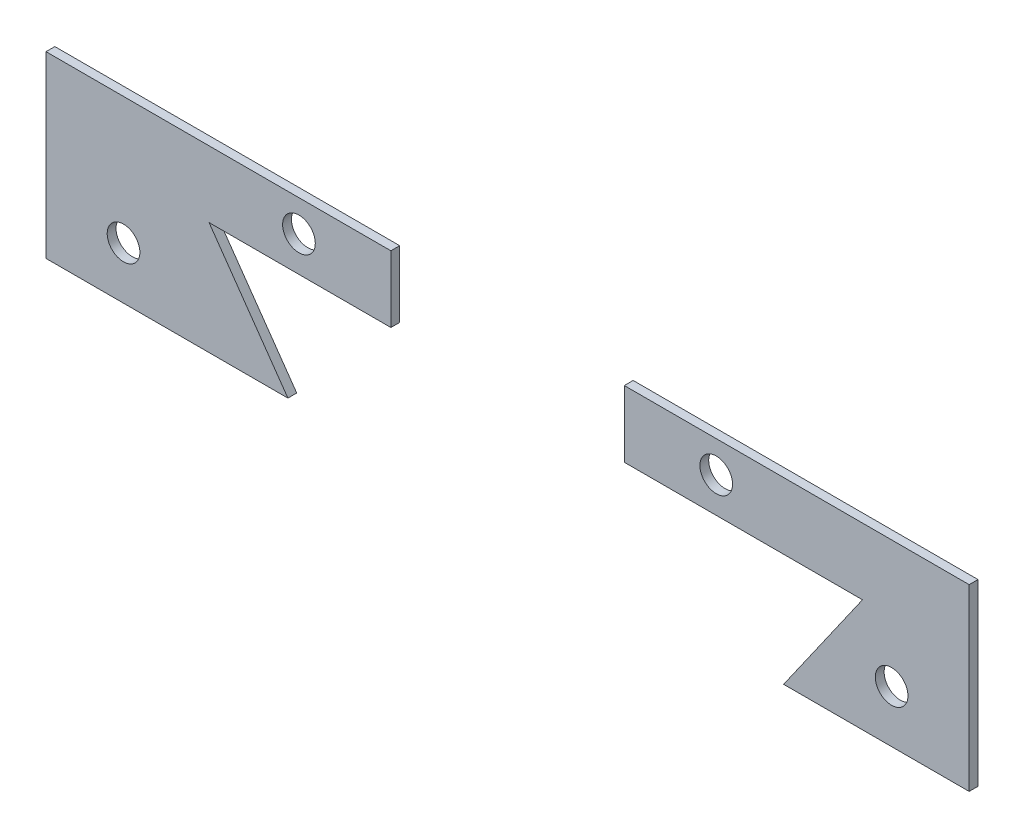
from build123d import *

# Parameters (mm, degrees)
BOSS_EXTRUDE1_DEPTH            = 1.21412
BOSS_EXTRUDE1_2_DEPTH          = 1.21412
SKETCH3_W                      = 2.2479
SKETCH3_H                      = 1.21412
F_8_CLEARANCE_HOLE1_AT_2_COUNT = 2
F_8_CLEARANCE_HOLE1_AT_2_PITCH = 27.477896212
F_8_CLEARANCE_HOLE1_AT_3_COUNT = 2
F_8_CLEARANCE_HOLE1_AT_3_PITCH = 57.404
F_8_CLEARANCE_HOLE1_AT_4_COUNT = 2
F_8_CLEARANCE_HOLE1_AT_4_PITCH = 82.586748551


with BuildPart() as part:
    # Sketch1 → Boss-Extrude1 (new body)
    with BuildSketch(Plane.XY):
        Polygon((-63.5, 0.762), (-30.221075073, 0.762), (-41.07009067, 16.256), (-16.056336319, 16.256), (-16.056336319, 25.4), (-63.5, 25.4), align=None)
    extrude(amount=BOSS_EXTRUDE1_DEPTH)

    # Sketch3 → #8 Clearance Hole1 (revolve, cut)
    with BuildSketch(Plane(origin=(-28.702, 21.082, 1.21412), x_dir=(0, -1, 0), z_dir=(1, 0, 0))):
        with Locations((1.12395, 0.60706)):
            Rectangle(SKETCH3_W, SKETCH3_H)
    f_8_clearance_hole1 = revolve(axis=Axis((-28.702, 21.082, 7.56412), (0, 0, -1)), mode=Mode.SUBTRACT)

    # #8 Clearance Hole1 at 2: #8 Clearance Hole1 ×2
    with Locations(*[Vector(-0.878160388030778, -0.47836631663781826, 0) * (i * F_8_CLEARANCE_HOLE1_AT_2_PITCH) for i in range(1, F_8_CLEARANCE_HOLE1_AT_2_COUNT)]):
        add(f_8_clearance_hole1, mode=Mode.SUBTRACT)


with BuildPart() as body_2:
    # Sketch1 → Boss-Extrude1 2 (new body)
    with BuildSketch(Plane.XY):
        Polygon((16.056336319, 16.256), (48.822009309, 16.256), (37.972993712, 0.762), (63.5, 0.762), (63.5, 25.4), (16.056336319, 25.4), align=None)
    extrude(amount=BOSS_EXTRUDE1_2_DEPTH)

    # #8 Clearance Hole1 at 3: #8 Clearance Hole1 ×2
    with Locations(*[(i * F_8_CLEARANCE_HOLE1_AT_3_PITCH, 0, 0) for i in range(1, F_8_CLEARANCE_HOLE1_AT_3_COUNT)]):
        add(f_8_clearance_hole1, mode=Mode.SUBTRACT)

    # #8 Clearance Hole1 at 4: #8 Clearance Hole1 ×2
    with Locations(*[Vector(0.9872528151354362, -0.15915991645875022, 0) * (i * F_8_CLEARANCE_HOLE1_AT_4_PITCH) for i in range(1, F_8_CLEARANCE_HOLE1_AT_4_COUNT)]):
        add(f_8_clearance_hole1, mode=Mode.SUBTRACT)


solid = Compound([part.part, body_2.part])
